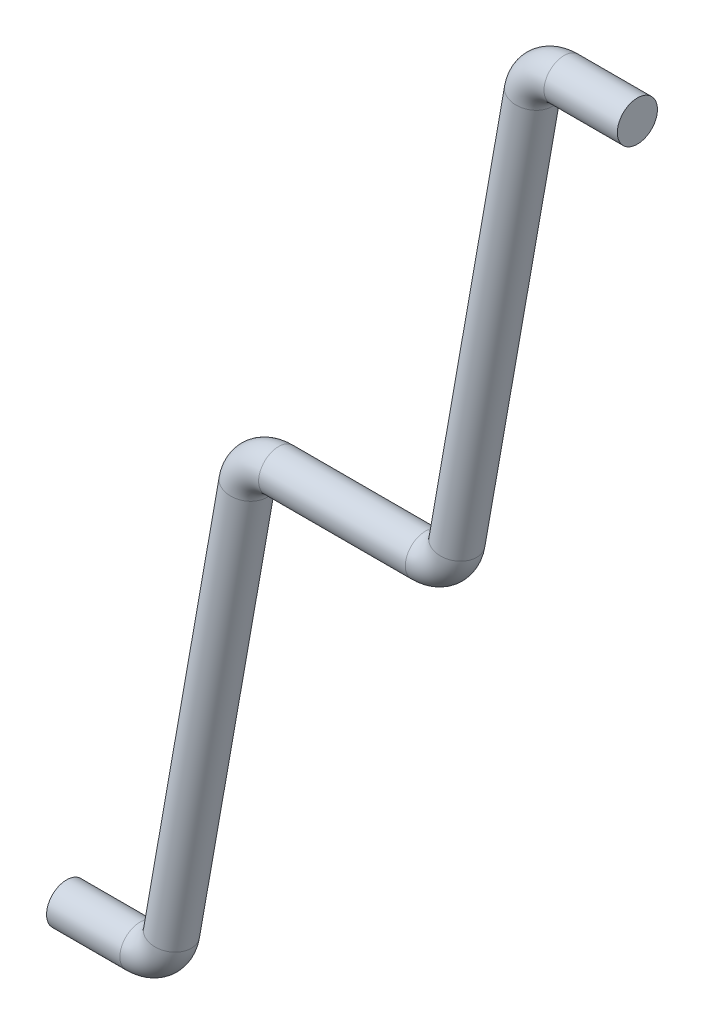
from build123d import *

# Parameters (mm, degrees)
SKETCH4_R = 6.35


with BuildPart() as part:
    # Sweep3: sweep along a path in Sketch5
    with BuildLine(Plane.XY) as sweep3_path:
        Line((0, 0), (23.224747747, 0))
        ThreePointArc((23.224747747, 0), (29.755469862, 2.376988458), (33.230394518, 8.395734515))
        Line((33.230394518, 8.395734515), (57.141837342, 144.004265485))
        ThreePointArc((57.141837342, 144.004265485), (60.616761998, 150.023011542), (67.147484113, 152.4))
        Line((67.147484113, 152.4), (90.37223186, 152.4))
        Line((90.37223186, 152.4), (113.596979607, 152.4))
        ThreePointArc((113.596979607, 152.4), (120.127701722, 154.776988458), (123.602626378, 160.795734515))
        Line((123.602626378, 160.795734515), (147.514069202, 296.404265485))
        ThreePointArc((147.514069202, 296.404265485), (150.988993858, 302.423011542), (157.519715973, 304.8))
        Line((157.519715973, 304.8), (180.74446372, 304.8))
    # Sketch4 → Sweep3 (sweep)
    with BuildSketch(Plane(origin=(0, 0, 0), x_dir=(0, 0, -1), z_dir=(1, 0, 0))):
        Circle(SKETCH4_R)
    sweep(path=sweep3_path.line)


solid = part.part
